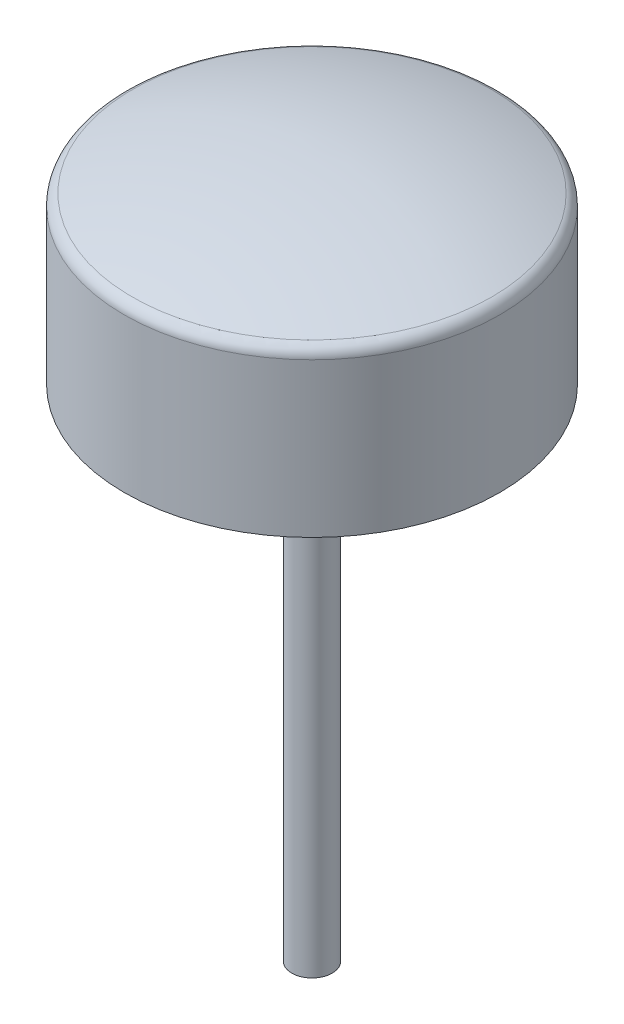
from build123d import *

# Parameters (mm, degrees)
BOSS_EXTRUDE1_DEPTH             = 1
BOSS_EXTRUDE2_DEPTH             = 1
BOSS_EXTRUDE3_DEPTH             = 1
SKETCH5_R                       = 1.658940309
BOSS_EXTRUDE4_DEPTH             = 41
BOSS_EXTRUDE4_DIRECTION_2_REACH = 24.097
SKETCH6_R                       = 15.395853367
SKETCH6_R_2                     = 14.395853367
BOSS_EXTRUDE5_DEPTH             = 12
SKETCH7_R                       = 15.395853367
BOSS_EXTRUDE6_DEPTH             = 11
FILLET1_R                       = 1


with BuildPart() as part:
    # Sketch2 → Boss-Extrude1 (new body)
    with BuildSketch(Plane(origin=(0, 0, 0), x_dir=(0.7071067811865464, 0.7071067811865488, 0), z_dir=(-0.7071067811865488, 0.7071067811865464, 0))):
        with BuildLine():
            Line((12.798517198, 3.429352348), (0, 0))
            Line((0, 0), (0, -13.25))
            ThreePointArc((0, -13.25), (11.941121051, -9.162744449), (12.798517198, 3.429352348))
        make_face()
    extrude(amount=BOSS_EXTRUDE1_DEPTH)

    # Sketch3 → Boss-Extrude2 (add)
    with BuildSketch(Plane(origin=(0, 0, 0), x_dir=(0.9267766952966354, -0.3535533905932773, 0.1268264840443233), z_dir=(0.3535533905932773, 0.7071067811865464, -0.6123724356957939))):
        with BuildLine():
            Line((-3.995589253, -14.911742098), (0, 0))
            Line((0, 0), (-11.477103172, 6.626308606))
            ThreePointArc((-11.477103172, 6.626308606), (-13.346478341, -6.091466992), (-3.995589253, -14.911742098))
        make_face()
    extrude(amount=BOSS_EXTRUDE2_DEPTH)

    # Sketch4 → Boss-Extrude3 (add)
    with BuildSketch(Plane(origin=(0, 0, 0), x_dir=(0.926776695296639, -0.35355339059326873, -0.1268264840443212), z_dir=(0.3535533905932687, 0.7071067811865464, 0.6123724356957988))):
        with BuildLine():
            Line((-9.369164851, 9.369164851), (0, 0))
            Line((0, 0), (10.80558923, 6.238609851))
            ThreePointArc((10.80558923, 6.238609851), (1.834027886, 14.994723252), (-9.369164851, 9.369164851))
        make_face()
    extrude(amount=BOSS_EXTRUDE3_DEPTH)


with BuildPart() as body_2:
    # Sketch5 → Boss-Extrude4 (new body)
    with BuildSketch(Plane(origin=(0, 0, 0), x_dir=(1, 0, 0), z_dir=(0, 1, 0))):
        Circle(SKETCH5_R)
    extrude(amount=-BOSS_EXTRUDE4_DEPTH)


    # Boss-Extrude4 direction 2: up to this face of the body (flat: up to its plane)
    boss_extrude4_direction_2_end = Plane(part.part.faces().sort_by_distance((-6.525054455, 5.025095219, 2.035238209))[0])
    # Sketch5 → Boss-Extrude4 direction 2 (add, up to the picked face)
    with BuildSketch(Plane(origin=(0, 0, 0), x_dir=(1, 0, 0), z_dir=(0, 1, 0)), mode=Mode.PRIVATE) as boss_extrude4_direction_2_sk1:
        Circle(SKETCH5_R)
    boss_extrude4_direction_2_tool1 = split(extrude(boss_extrude4_direction_2_sk1.sketch, amount=BOSS_EXTRUDE4_DIRECTION_2_REACH, mode=Mode.PRIVATE), bisect_by=boss_extrude4_direction_2_end, keep=Keep.BOTH, mode=Mode.PRIVATE)
    add(boss_extrude4_direction_2_tool1.solids().sort_by(Axis((0, 0, 0), (0, 1, 0)))[0])


with BuildPart() as body_3:
    # Sketch6 → Boss-Extrude5 (new body)
    with BuildSketch(Plane(origin=(0, 0, 0), x_dir=(1, 0, 0), z_dir=(0, 1, 0))):
        Circle(SKETCH6_R)
        Circle(SKETCH6_R_2, mode=Mode.SUBTRACT)
    extrude(amount=BOSS_EXTRUDE5_DEPTH)

    # Sketch7 → Boss-Extrude6 (add)
    with BuildSketch(Plane(origin=(0, 12, 0), x_dir=(1, 0, 0), z_dir=(0, 1, 0))):
        Circle(SKETCH7_R)
    extrude(amount=BOSS_EXTRUDE6_DEPTH)

    # Sketch8 → Cut-Revolve2 (revolve, cut)
    with BuildSketch(Plane.XY):
        with BuildLine():
            Line((0, 16.148504019), (0, 23.90296441))
            Line((0, 23.90296441), (16.293851605, 23.90296441))
            Line((16.293851605, 23.90296441), (16.293851605, 12.959716191))
            ThreePointArc((16.293851605, 12.959716191), (8.30147529, 15.343816585), (0, 16.148504019))
        make_face()
    revolve(axis=Axis((0, 16.148504019, 0), (0, 1, 0)), mode=Mode.SUBTRACT)

    # Fillet1
    fillet1_edges = [body_3.edges().sort_by_distance(p)[0] for p in [
        (-15.395853365, 13.313564653, 0),
    ]]
    fillet(fillet1_edges, radius=FILLET1_R)


solid = Compound([part.part, body_2.part, body_3.part])
